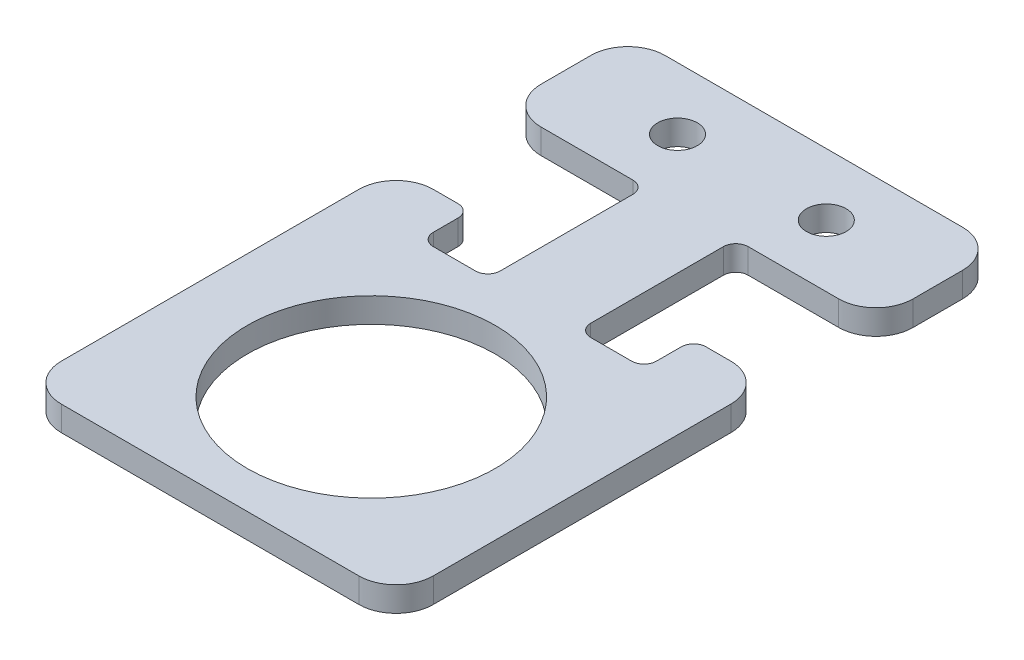
from build123d import *

# Parameters (mm, degrees)
SM_BASE_FLANGE_1_DEPTH = 2
CUT_EXTRUDE_1_DEPTH    = 10
FILLET_1_R             = 3
FILLET_2_R             = 1
CUT_EXTRUDE_3_DEPTH    = 10


# Sheet-metal steps are written as plain solids
with BuildPart() as part:
    # Sketch 1 → 基体-法兰1 (new body)
    with BuildSketch(Plane(origin=(0, 0, 0), x_dir=(1, 0, 0), z_dir=(0, 1, 0))):
        Polygon((15, 15), (9, 15), (9, 11), (3.7, 11), (3.7, 15), (3.7, 23.7), (15, 23.7), (15, 33.7), (-15, 33.7), (-15, 23.7), (-3.6, 23.7), (-3.6, 15), (-3.6, 11), (-9, 11), (-9, 15), (-15, 15), (-15, -15), (15, -15), align=None)
    extrude(amount=-SM_BASE_FLANGE_1_DEPTH)

    # 草图6 → 切除-拉伸1 (cut)
    with BuildSketch(Plane(origin=(0, 0, 0), x_dir=(1, 0, 0), z_dir=(0, 1, 0))):
        with BuildLine():
            Line((-7.6, 28.7), (-6, 28.7))
            Line((-6, 28.7), (-4.4, 28.7))
            ThreePointArc((-4.4, 28.7), (-6, 30.3), (-7.6, 28.7))
        make_face()
        with BuildLine():
            Line((-4.4, 28.7), (-6, 28.7))
            Line((-6, 28.7), (-7.6, 28.7))
            ThreePointArc((-7.6, 28.7), (-6, 27.1), (-4.4, 28.7))
        make_face()
        with BuildLine():
            ThreePointArc((7.6, 28.7), (6, 30.3), (4.4, 28.7))
            Line((4.4, 28.7), (6, 28.7))
            Line((6, 28.7), (7.6, 28.7))
        make_face()
        with BuildLine():
            Line((6, 28.7), (4.4, 28.7))
            ThreePointArc((4.4, 28.7), (6, 27.1), (7.6, 28.7))
            Line((7.6, 28.7), (6, 28.7))
        make_face()
    extrude(amount=-CUT_EXTRUDE_1_DEPTH, mode=Mode.SUBTRACT)

    # 圆角1
    fillet_1_edges = [part.edges().sort_by_distance(p)[0] for p in [
        (15, -1, 15),
        (-15, -1, 15),
        (-15, -1, -15),
        (-15, -1, -23.7),
        (-15, -1, -33.7),
        (15, -1, -33.7),
        (15, -1, -23.7),
        (15, -1, -15),
    ]]
    fillet(fillet_1_edges, radius=FILLET_1_R)

    # 圆角2
    fillet_2_edges = [part.edges().sort_by_distance(p)[0] for p in [
        (-9, -1, -15),
        (-9, -1, -11),
        (-3.6, -1, -11),
        (-3.6, -1, -23.7),
        (3.7, -1, -23.7),
        (3.7, -1, -11),
        (9, -1, -11),
        (9, -1, -15),
    ]]
    fillet(fillet_2_edges, radius=FILLET_2_R)

    # 草图7 → 切除-拉伸3 (cut)
    with BuildSketch(Plane(origin=(0, 0, 0), x_dir=(1, 0, 0), z_dir=(0, 1, 0))):
        with BuildLine():
            ThreePointArc((-10, -2), (0, -12), (10, -2))
            Line((10, -2), (-10, -2))
        make_face()
        with BuildLine():
            Line((-10, -2), (10, -2))
            ThreePointArc((10, -2), (0, 8), (-10, -2))
        make_face()
    extrude(amount=-CUT_EXTRUDE_3_DEPTH, mode=Mode.SUBTRACT)


solid = part.part
